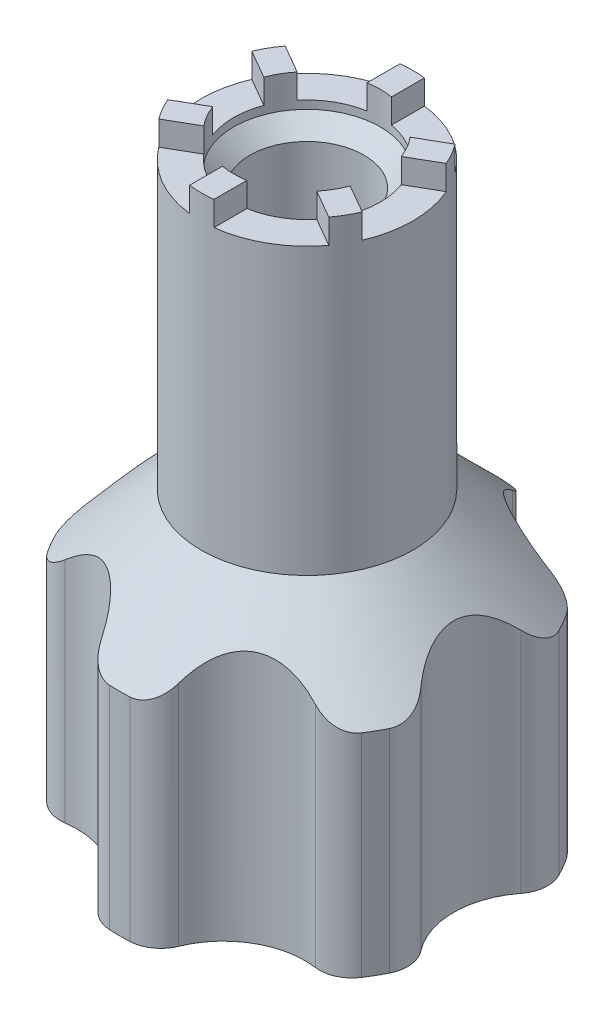
from build123d import *

# Parameters (mm, degrees)
CUT_EXTRUDE_1_DEPTH      = 1.5
CUT_EXTRUDE_2_DEPTH      = 41.416580756
CUT_EXTRUDE_2_DEPTH_BACK = 13.5
FILLET_1_R               = 1
SKETCH_4_R               = 5
CUT_EXTRUDE_3_DEPTH      = 41.416580756
FILLET_3_R               = 2


with BuildPart() as part:
    # Эскиз1 → Повернуть1 (revolve)
    with BuildSketch(Plane.XY, mode=Mode.PRIVATE) as revolve_1_sk:
        Polygon((-6.75, 0), (-11.5, 0), (-11.5, 13), (-6.5, 18), (-6.5, 37), (-4.5, 37), (-4.5, 35), (-3.5, 34), (-3.5, 18.5), (0, 18.5), (0, 14.5), (-5, 14.5), (-5, 13.5), (-6.75, 13.5), align=None)
    revolve(revolve_1_sk.sketch.rotate(Axis((0, 0, 0), (0, -1, 0)), 270), axis=Axis((0, 0, 0), (0, -1, 0)))

    # Эскиз2 → Вырез-Вытянуть1 (cut)
    with BuildSketch(Plane(origin=(0, 37, 0), x_dir=(1, 0, 0), z_dir=(0, 1, 0))):
        with BuildLine():
            Line((-0.75, 3.418698583), (-0.75, 6.456585785))
            ThreePointArc((-0.75, 6.456585785), (-3.25, 5.629165125), (-5.216567312, 3.877811945))
            Line((-5.216567312, 3.877811945), (-2.585679821, 2.358868344))
            ThreePointArc((-2.585679821, 2.358868344), (-1.75, 3.031088913), (-0.75, 3.418698583))
        make_face()
        with BuildLine():
            ThreePointArc((5.216567312, 3.877811945), (3.25, 5.629165125), (0.75, 6.456585785))
            Line((0.75, 6.456585785), (0.75, 3.418698583))
            ThreePointArc((0.75, 3.418698583), (1.75, 3.031088913), (2.585679821, 2.358868344))
            Line((2.585679821, 2.358868344), (5.216567312, 3.877811945))
        make_face()
        with BuildLine():
            Line((-3.335679821, 1.059830239), (-5.966567312, 2.57877384))
            ThreePointArc((-5.966567312, 2.57877384), (-6.5, 0), (-5.966567312, -2.57877384))
            Line((-5.966567312, -2.57877384), (-3.335679821, -1.059830239))
            ThreePointArc((-3.335679821, -1.059830239), (-3.5, 0), (-3.335679821, 1.059830239))
        make_face()
        with BuildLine():
            ThreePointArc((5.966567312, -2.57877384), (6.5, 0), (5.966567312, 2.57877384))
            Line((5.966567312, 2.57877384), (3.335679821, 1.059830239))
            ThreePointArc((3.335679821, 1.059830239), (3.5, 0), (3.335679821, -1.059830239))
            Line((3.335679821, -1.059830239), (5.966567312, -2.57877384))
        make_face()
        with BuildLine():
            Line((-2.585679821, -2.358868344), (-5.216567312, -3.877811945))
            ThreePointArc((-5.216567312, -3.877811945), (-3.25, -5.629165125), (-0.75, -6.456585785))
            Line((-0.75, -6.456585785), (-0.75, -3.418698583))
            ThreePointArc((-0.75, -3.418698583), (-1.75, -3.031088913), (-2.585679821, -2.358868344))
        make_face()
        with BuildLine():
            ThreePointArc((0.75, -6.456585785), (3.25, -5.629165125), (5.216567312, -3.877811945))
            Line((5.216567312, -3.877811945), (2.585679821, -2.358868344))
            ThreePointArc((2.585679821, -2.358868344), (1.75, -3.031088913), (0.75, -3.418698583))
            Line((0.75, -3.418698583), (0.75, -6.456585785))
        make_face()
    extrude(amount=-CUT_EXTRUDE_1_DEPTH, mode=Mode.SUBTRACT)

    # Эскиз3 → Вырез-Вытянуть2 (cut, two sides: drawn at the far end of the back side and taken through both)
    with BuildSketch(Plane(origin=(0, 0, 0), x_dir=(-1, 0, 0), z_dir=(0, -1, 0)).offset(-CUT_EXTRUDE_2_DEPTH_BACK)):
        with BuildLine():
            ThreePointArc((-1.25, -9.31651759), (0, -9.4), (1.25, -9.31651759))
            Line((1.25, -9.31651759), (2.020637312, -6.440459988))
            ThreePointArc((2.020637312, -6.440459988), (0, -6.75), (-2.020637312, -6.440459988))
            Line((-2.020637312, -6.440459988), (-1.25, -9.31651759))
        make_face()
        with BuildLine():
            ThreePointArc((-8.693340908, -3.57572704), (-8.140638796, -4.7), (-7.443340908, -5.74079055))
            Line((-7.443340908, -5.74079055), (-4.567283306, -4.970153238))
            ThreePointArc((-4.567283306, -4.970153238), (-5.845671476, -3.375), (-6.587920617, -1.47030675))
            Line((-6.587920617, -1.47030675), (-8.693340908, -3.57572704))
        make_face()
        with BuildLine():
            ThreePointArc((-7.443340908, 5.74079055), (-8.140638796, 4.7), (-8.693340908, 3.57572704))
            Line((-8.693340908, 3.57572704), (-6.587920617, 1.47030675))
            ThreePointArc((-6.587920617, 1.47030675), (-5.845671476, 3.375), (-4.567283306, 4.970153238))
            Line((-4.567283306, 4.970153238), (-7.443340908, 5.74079055))
        make_face()
        with BuildLine():
            ThreePointArc((1.25, 9.31651759), (0, 9.4), (-1.25, 9.31651759))
            Line((-1.25, 9.31651759), (-2.020637312, 6.440459988))
            ThreePointArc((-2.020637312, 6.440459988), (0, 6.75), (2.020637312, 6.440459988))
            Line((2.020637312, 6.440459988), (1.25, 9.31651759))
        make_face()
        with BuildLine():
            Line((6.587920617, 1.47030675), (8.693340908, 3.57572704))
            ThreePointArc((8.693340908, 3.57572704), (8.140638796, 4.7), (7.443340908, 5.74079055))
            Line((7.443340908, 5.74079055), (4.567283306, 4.970153238))
            ThreePointArc((4.567283306, 4.970153238), (5.845671476, 3.375), (6.587920617, 1.47030675))
        make_face()
        with BuildLine():
            Line((4.567283306, -4.970153238), (7.443340908, -5.74079055))
            ThreePointArc((7.443340908, -5.74079055), (8.140638796, -4.7), (8.693340908, -3.57572704))
            Line((8.693340908, -3.57572704), (6.587920617, -1.47030675))
            ThreePointArc((6.587920617, -1.47030675), (5.845671476, -3.375), (4.567283306, -4.970153238))
        make_face()
    extrude(amount=CUT_EXTRUDE_2_DEPTH + CUT_EXTRUDE_2_DEPTH_BACK, mode=Mode.SUBTRACT)

    # Скругление1
    fillet_1_edges = [part.edges().sort_by_distance(p)[0] for p in [
        (-7.443340908, 6.75, 5.74079055),
        (-8.693340908, 6.75, 3.57572704),
        (-8.693340908, 6.75, -3.57572704),
        (-7.443340908, 6.75, -5.74079055),
        (-1.25, 6.75, -9.31651759),
        (1.25, 6.75, -9.31651759),
        (7.443340908, 6.75, -5.74079055),
        (8.693340908, 6.75, -3.57572704),
        (8.693340908, 6.75, 3.57572704),
        (7.443340908, 6.75, 5.74079055),
        (1.25, 6.75, 9.31651759),
        (-1.25, 6.75, 9.31651759),
    ]]
    fillet(fillet_1_edges, radius=FILLET_1_R)

    # Эскиз4 → Вырез-Вытянуть3 (cut, through all)
    with BuildSketch(Plane(origin=(0, 0, 0), x_dir=(-1, 0, 0), z_dir=(0, -1, 0))):
        with Locations((-14, 0)):
            Circle(SKETCH_4_R)
        with Locations((-7, 12.124355653)):
            Circle(SKETCH_4_R)
        with Locations((7, 12.124355653)):
            Circle(SKETCH_4_R)
        with Locations((14, 0)):
            Circle(SKETCH_4_R)
        with Locations((7, -12.124355653)):
            Circle(SKETCH_4_R)
        with Locations((-7, -12.124355653)):
            Circle(SKETCH_4_R)
    extrude(amount=-CUT_EXTRUDE_3_DEPTH, mode=Mode.SUBTRACT)

    # Скругление3
    # the kernel refuses this fillet: 2 mm, written as the material it takes off along each edge
    with BuildSketch(Plane(origin=(8.764062433, -3.628394321, 7.445885419), x_dir=(0.5980879834727268, 0, -0.8014304486513644), z_dir=(0, 1, 0)), Plane(origin=(10.830357143, -3.628394321, -3.866957998), x_dir=(-0.39501513616206874, 0, -0.9186746117112752), z_dir=(0, 1, 0)), Plane(origin=(-2.06629471, -3.628394321, 11.312843417), x_dir=(0.9931031196348049, 0, 0.11724416305990884), z_dir=(0, 1, 0)), Plane(origin=(-10.830357143, -3.628394321, 3.866957998), x_dir=(0.39501513616207456, 0, 0.9186746117112726), z_dir=(0, 1, 0)), Plane(origin=(-8.764062433, -3.628394321, -7.445885419), x_dir=(-0.5980879834727313, 0, 0.8014304486513609), z_dir=(0, 1, 0)), Plane(origin=(2.06629471, -3.628394321, -11.312843417), x_dir=(-0.993103119634804, 0, -0.11724416305991678), z_dir=(0, 1, 0))) as fillet_3_piece_1:
        with BuildLine():
            CenterArc((1.325152708, 1.996014101), FILLET_3_R, 208.875702685, 64.742208568)
            ThreePointArc((-0.426186077, 1.030191935), (-0.184290066, 0.527011636), (0, 0))
            ThreePointArc((0, 0), (0.725678864, -0.022918917), (1.451357728, 0))
        make_face()
    extrude(amount=20.256788642, mode=Mode.SUBTRACT)
    with BuildSketch(Plane(origin=(2.06629471, -3.628394321, 11.312843417), x_dir=(0.27129921419847874, 0, -0.9624950578446041), z_dir=(0, 1, 0)), Plane(origin=(10.830357143, -3.628394321, 3.866957998), x_dir=(-0.6978955640111515, 0, -0.7161995404449494), z_dir=(0, 1, 0)), Plane(origin=(-10.830357143, -3.628394321, -3.866957998), x_dir=(0.6978955640111574, 0, 0.7161995404449437), z_dir=(0, 1, 0)), Plane(origin=(-2.06629471, -3.628394321, -11.312843417), x_dir=(-0.27129921419848646, 0, 0.962495057844602), z_dir=(0, 1, 0)), Plane(origin=(8.764062433, -3.628394321, -7.445885419), x_dir=(-0.9691947782096418, 0, 0.24629551739965397), z_dir=(0, 1, 0))) as fillet_3_piece_2:
        with BuildLine():
            CenterArc((1.337841244, 1.987531836), FILLET_3_R, 198.856762973, 64.742208568)
            ThreePointArc((-0.55481781, 1.34112507), (-0.298587098, 0.661801206), (0, 0))
            ThreePointArc((0, 0), (0.557433852, 0.031170409), (1.114867703, 0))
        make_face()
    extrude(amount=20.256788642, mode=Mode.SUBTRACT)
    with BuildSketch(Plane(origin=(-8.764062433, -3.628394321, 7.445885419), x_dir=(-0.5980879834727432, 0, -0.8014304486513523), z_dir=(0, 1, 0))) as fillet_3_piece_3:
        with BuildLine():
            CenterArc((1.325152708, -1.996014101), FILLET_3_R, 86.382088747, 64.742208568)
            ThreePointArc((-0.426186077, -1.030191935), (-0.184290066, -0.527011636), (0, 0))
            ThreePointArc((0, 0), (0.725678864, 0.022918917), (1.451357728, 0))
        make_face()
    extrude(amount=20.256788642, mode=Mode.SUBTRACT)


solid = part.part
